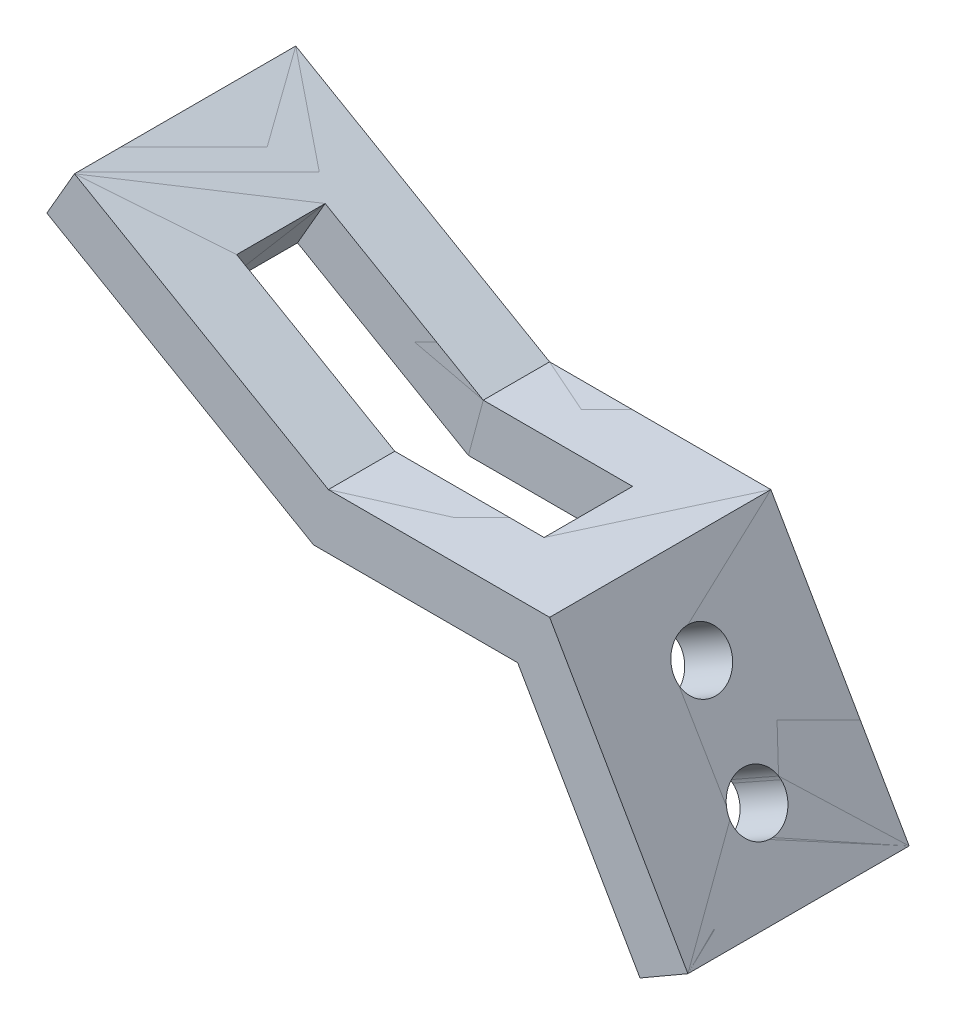
from build123d import *

# Parameters (mm, degrees)
EXTRUDE_THIN1_START   = -20
EXTRUDE_THIN1_DEPTH   = 40
EXTRUDE_THIN1_2_DEPTH = 40
CUT_EXTRUDE1_DEPTH    = 8
SKETCH4_R             = 5
CUT_EXTRUDE2_DEPTH    = 107.070363583


# Read off the part's stored shape, not the designer's step: Extrude-Thin1
with BuildPart() as part:
    # Extrude-Thin1 outline → Extrude-Thin1 (new body)
    with BuildSketch(Plane.XY.offset(EXTRUDE_THIN1_START)):
        Polygon((0, 0), (-45.899346401, 26.5), (-50.899346401, 17.839745962), (-2.679491924, -10), (34.226497308, -10), (56.339745962, -48.301270189), (65, -43.301270189), (40, 0), align=None)
    extrude(amount=EXTRUDE_THIN1_DEPTH)


with BuildPart() as body_2:
    # Extrude-Thin1 2 outline → Extrude-Thin1 2 (new body)
    with BuildSketch(Plane.XY.offset(EXTRUDE_THIN1_START)):
        Polygon((-2.679491924, -10), (34.226497308, -10), (56.339745962, -48.301270189), (65, -43.301270189), (40, 0), (0, 0), (-45.899346401, 26.5), (-50.899346401, 17.839745962), align=None)
    extrude(amount=EXTRUDE_THIN1_2_DEPTH)


with BuildPart() as cut_extrude1_tool:
    # Sketch3 → Cut-Extrude1 (new, symmetric)
    with BuildSketch(Plane.XY):
        Polygon((-28.578838325, 16.5), (-33.578838325, 7.839745962), (-2.679491924, -10), (27, -10), (27, 0), (0, 0), align=None)
    extrude(amount=CUT_EXTRUDE1_DEPTH, both=True)


with BuildPart() as part_1:
    add(part.part)

    # Cut-Extrude1: cut by cut_extrude1_tool
    add(cut_extrude1_tool.part, mode=Mode.SUBTRACT)


with BuildPart() as body_2_1:
    add(body_2.part)

    # Cut-Extrude1: cut by cut_extrude1_tool
    add(cut_extrude1_tool.part, mode=Mode.SUBTRACT)


with BuildPart() as cut_extrude2_tool:
    # Sketch4 → Cut-Extrude2 (new, through all)
    with BuildSketch(Plane(origin=(30, 17.320508076, 0), x_dir=(0, 0, -1), z_dir=(0.8660254037844378, 0.5000000000000016, 0))):
        with Locations(Location((0, -35, 0), (0, 0, 90))):
            Circle(SKETCH4_R)
        with Locations(Location((0, -55, 0), (0, 0, 90))):
            Circle(SKETCH4_R)
    extrude(amount=-CUT_EXTRUDE2_DEPTH)


with BuildPart() as part_2:
    add(part_1.part)

    # Cut-Extrude2: cut by cut_extrude2_tool
    add(cut_extrude2_tool.part, mode=Mode.SUBTRACT)


with BuildPart() as body_2_2:
    add(body_2_1.part)

    # Cut-Extrude2: cut by cut_extrude2_tool
    add(cut_extrude2_tool.part, mode=Mode.SUBTRACT)


solid = Compound([part_2.part, body_2_2.part])
